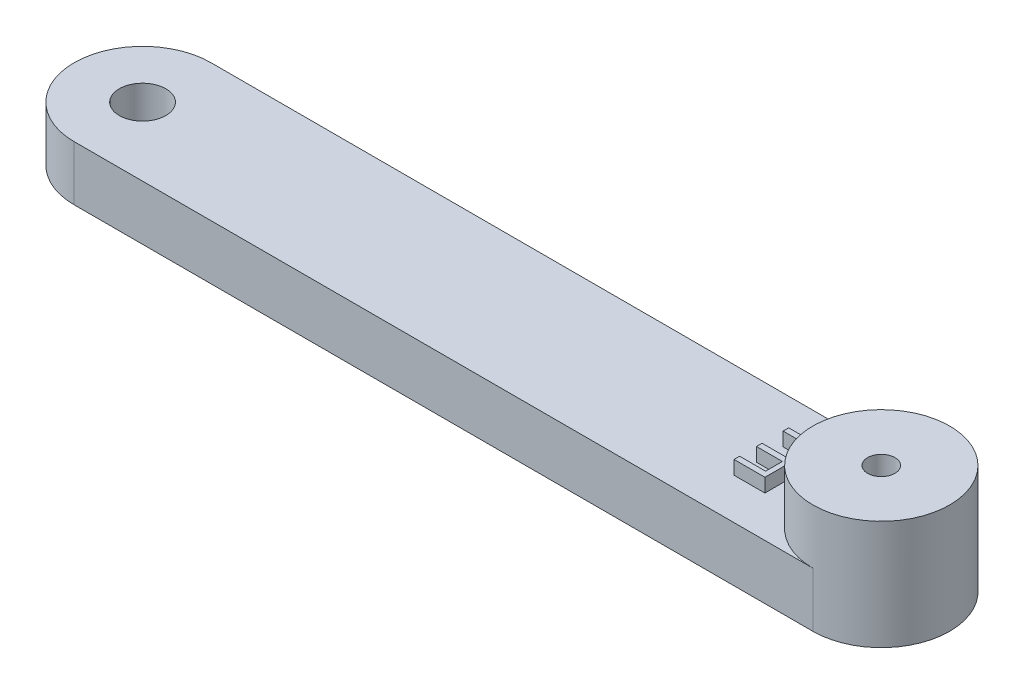
from build123d import *
from build123d.topology import SkipClean

# Parameters (mm, degrees)
RESSALTO_EXTRUS_O1_DEPTH = 2
ESBO_O2_R                = 0.85
CORTE_EXTRUS_O1_DEPTH    = 17.317168872
ESBO_O4_R                = 2.5
RESSALTO_EXTRUS_O2_DEPTH = 2
CORTE_EXTRUS_O2_REACH    = 18.681
ESBO_O3_R                = 0.5
RESSALTO_EXTRUS_O3_DEPTH = 0.5


with BuildPart() as part:
    # Esboço1 → Ressalto-extrusão1 (new body)
    with BuildSketch(Plane(origin=(0, 0, 0), x_dir=(1, 0, 0), z_dir=(0, 1, 0))):
        with BuildLine():
            Line((-13.5, 2.5), (13.5, 2.5))
            ThreePointArc((13.5, 2.5), (16, 0), (13.5, -2.5))
            Line((13.5, -2.5), (-13.5, -2.5))
            ThreePointArc((-13.5, -2.5), (-16, 0), (-13.5, 2.5))
        make_face()
    extrude(amount=RESSALTO_EXTRUS_O1_DEPTH)

    # Esboço2 → Corte-extrusão1 (cut, through all)
    with BuildSketch(Plane(origin=(0, 2, 0), x_dir=(1, 0, 0), z_dir=(0, 1, 0))):
        with Locations((-13.5, 0)):
            Circle(ESBO_O2_R)
    extrude(amount=-CORTE_EXTRUS_O1_DEPTH, mode=Mode.SUBTRACT)

    # Esboço4 → Ressalto-extrusão2 (add)
    with SkipClean():  # the faces are left unmerged after this step: merging them gives an invalid solid
        with BuildSketch(Plane(origin=(0, 2, 0), x_dir=(1, 0, 0), z_dir=(0, 1, 0))):
            with Locations((13.5, 0)):
                Circle(ESBO_O4_R)
        extrude(amount=RESSALTO_EXTRUS_O2_DEPTH)
    add(part.part.scale(1), mode=Mode.REPLACE)  # the faces are merged on a copy

    # Esboço3 → Corte-extrusão2 (cut, up to next)
    with BuildSketch(Plane(origin=(0, 4, 0), x_dir=(1, 0, 0), z_dir=(0, 1, 0)), mode=Mode.PRIVATE) as corte_extrus_o2_sk1:
        with Locations((13.5, 0)):
            Circle(ESBO_O3_R)
    corte_extrus_o2_tool1 = extrude(corte_extrus_o2_sk1.sketch, amount=-CORTE_EXTRUS_O2_REACH, mode=Mode.PRIVATE) & part.part
    add(corte_extrus_o2_tool1.solids().sort_by_distance((13.5, 4, 0))[0], mode=Mode.SUBTRACT)

    # Esboço5 → Ressalto-extrusão3 (add)
    with BuildSketch(Plane(origin=(0, 2, 0), x_dir=(1, 0, 0), z_dir=(0, 1, 0))):
        Polygon((10.246141944, -1), (9.117936815, -1), (9.117936815, -0.794871795), (10.066654764, -0.794871795), (10.066654764, -0.179487179), (9.117936815, -0.179487179), (9.117936815, 0.025641026), (10.066654764, 0.025641026), (10.066654764, 0.794871795), (9.117936815, 0.794871795), (9.117936815, 1), (10.246141944, 1), align=None)
    extrude(amount=RESSALTO_EXTRUS_O3_DEPTH)


solid = part.part
